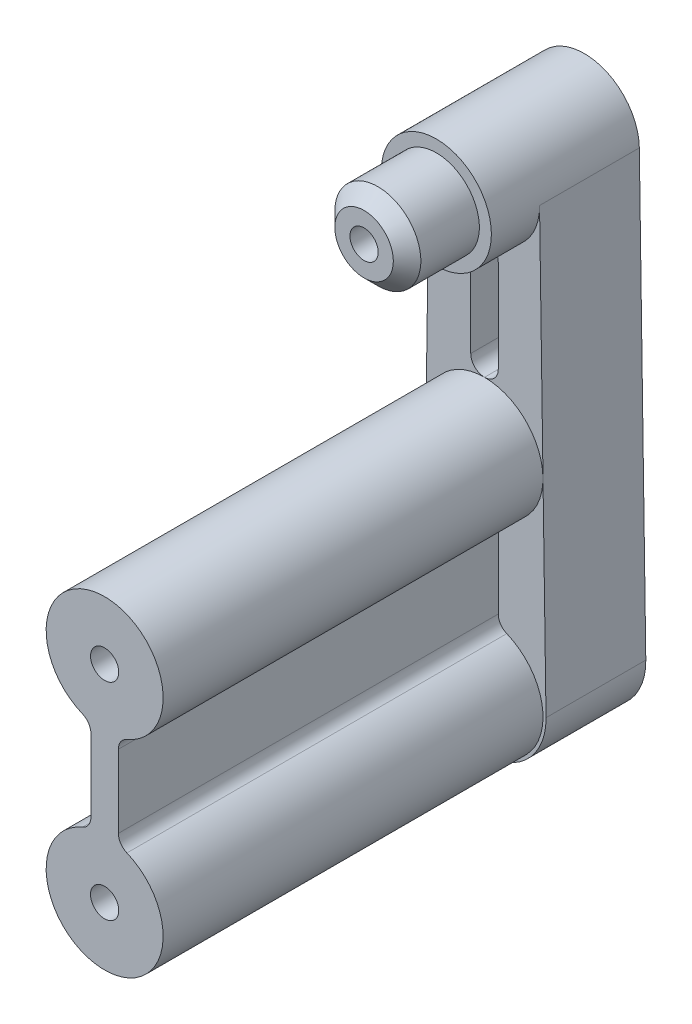
from build123d import *

# Parameters (mm, degrees)
BOSS_EXTRUDE1_DEPTH      = 5
BOSS_EXTRUDE3_START      = 5
SKETCH1_5_R              = 4
BOSS_EXTRUDE3_DEPTH      = 5.75
BOSS_EXTRUDE2_START      = 10.75
SKETCH1_4_R              = 3.125
BOSS_EXTRUDE2_DEPTH      = 5.25
BOSS_EXTRUDE4_START      = 5
SKETCH1_6_R              = 4.25
BOSS_EXTRUDE4_DEPTH      = 29.85
BOSS_EXTRUDE5_DEPTH      = 2.25
BOSS_EXTRUDE6_DEPTH      = 29.85
FILLET1_R                = 1
M2_5X0_45_TAPPED_HOLE1_D = 2.05
CHAMFER1_SIZE            = 1


# Read off the part's stored shape, not the designer's step: Boss-Extrude5
with BuildPart() as part:
    # Sketch1 → Boss-Extrude1 (new body)
    with BuildSketch(Plane.XY):
        with BuildLine():
            ThreePointArc((3.999567451, 32.058823529), (0, 36), (-3.999567451, 32.058823529))
            Line((-3.999567451, 32.058823529), (-4.470104798, 0.065743945))
            ThreePointArc((-4.470104798, 0.065743945), (0, -4.470588235), (4.470104798, 0.065743945))
            Line((4.470104798, 0.065743945), (3.999567451, 32.058823529))
        make_face()
    extrude(amount=BOSS_EXTRUDE1_DEPTH)

    # Sketch1<5> → Boss-Extrude3 (add)
    with BuildSketch(Plane.XY.offset(BOSS_EXTRUDE3_START)):
        with Locations(Location((0, 32, 0), (0, 0, 179.157384634))):
            Circle(SKETCH1_5_R)
    extrude(amount=BOSS_EXTRUDE3_DEPTH)

    # Sketch1<4> → Boss-Extrude2 (add)
    with BuildSketch(Plane.XY.offset(BOSS_EXTRUDE2_START)):
        with Locations(Location((0, 32, 0), (0, 0, 180))):
            Circle(SKETCH1_4_R)
    extrude(amount=BOSS_EXTRUDE2_DEPTH)

    # Sketch1<6> → Boss-Extrude4 (add)
    with BuildSketch(Plane.XY.offset(BOSS_EXTRUDE4_START)):
        Circle(SKETCH1_6_R)
        with Locations(Location((0, 15, 0), (0, 0, 179.157384634))):
            Circle(SKETCH1_6_R)
    extrude(amount=BOSS_EXTRUDE4_DEPTH)

    # Boss-Extrude5 outline → Boss-Extrude5 (add)
    with BuildSketch(Plane.XY.offset(5)):
        with BuildLine():
            Line((-4.249540417, 15.06249996), (-4.470104798, 0.065743945))
            ThreePointArc((-4.470104798, 0.065743945), (0, -4.470588235), (4.470104798, 0.065743945))
            Line((4.470104798, 0.065743945), (4.249540416, 15.062500001))
            ThreePointArc((4.249540416, 15.062500001), (3.35933087, 12.396656745), (1, 10.86932209))
            Line((1, 10.86932209), (1, 4.13067791))
            ThreePointArc((1, 4.13067791), (0, -4.25), (-1, 4.13067791))
            Line((-1, 4.13067791), (-1, 10.86932209))
            ThreePointArc((-1, 10.86932209), (-3.359330858, 12.396656729), (-4.249540417, 15.06249996))
        make_face()
        with BuildLine():
            Line((-3.999567451, 32.058823529), (-4.249540417, 15.06249996))
            ThreePointArc((-4.249540417, 15.06249996), (-3.320683154, 17.652463646), (-1, 19.13067791))
            Line((-1, 19.13067791), (-1, 28.127016654))
            ThreePointArc((-1, 28.127016654), (-3.18020361, 29.573829149), (-3.999567451, 32.058823529))
        make_face()
        with BuildLine():
            ThreePointArc((1, 19.13067791), (3.320683141, 17.652463662), (4.249540416, 15.062500001))
            Line((4.249540416, 15.062500001), (3.999567451, 32.058823529))
            ThreePointArc((3.999567451, 32.058823529), (3.18020361, 29.573829149), (1, 28.127016654))
            Line((1, 28.127016654), (1, 19.13067791))
        make_face()
    extrude(amount=BOSS_EXTRUDE5_DEPTH)

    # Sketch2<3> → Boss-Extrude6 (add)
    with BuildSketch(Plane.XY.offset(5)):
        with BuildLine():
            ThreePointArc((1, 10.86932209), (0, 10.75), (-1, 10.86932209))
            Line((-1, 10.86932209), (-1, 4.13067791))
            ThreePointArc((-1, 4.13067791), (0, 4.25), (1, 4.13067791))
            Line((1, 4.13067791), (1, 10.86932209))
        make_face()
    extrude(amount=BOSS_EXTRUDE6_DEPTH)

    # Fillet1
    fillet1_edges = [part.edges().sort_by_distance(p)[0] for p in [
        (1, 4.13067791, 21.05),
        (1, 10.86932209, 21.05),
        (-1, 4.13067791, 21.05),
        (-1, 10.86932209, 21.05),
        (-1, 28.127016654, 6.125),
        (1, 28.127016654, 6.125),
        (-1, 19.13067791, 6.125),
        (1, 19.13067791, 6.125),
    ]]
    fillet(fillet1_edges, radius=FILLET1_R - 0.0001)  # a hair under: the kernel refuses the full size

    # M2.5x0.45 Tapped Hole1 (through all)
    with Locations(Plane.XY.offset(34.85)):
        with Locations((0, 15), (0, 0), (0, 32)):
            Hole(M2_5X0_45_TAPPED_HOLE1_D / 2)

    # Chamfer1
    chamfer1_edges = [part.edges().sort_by_distance(p)[0] for p in [
        (3.125, 32, 16),
    ]]
    chamfer(chamfer1_edges, length=CHAMFER1_SIZE)


solid = part.part
